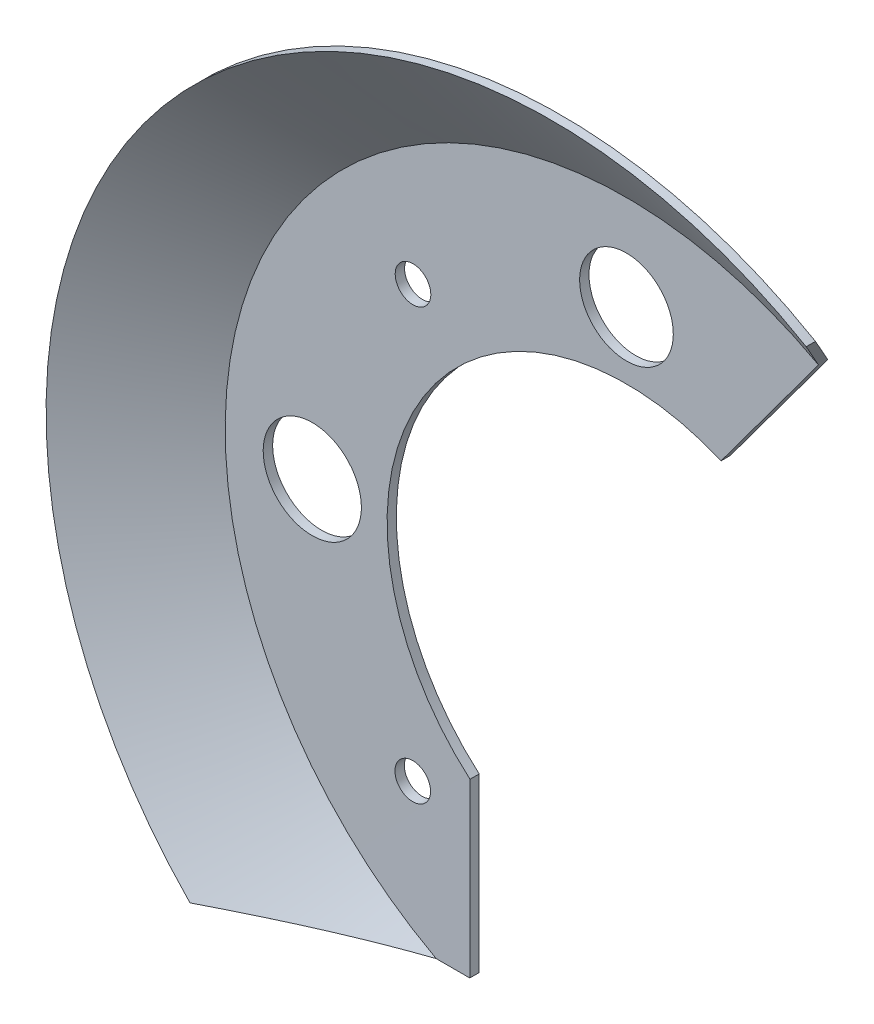
from build123d import *

# Parameters (mm, degrees)
CUT_EXTRUDE1_DEPTH      = 257.457873087
CUT_EXTRUDE1_DEPTH_BACK = 257.457873087
SKETCH5_R               = 6.35
CUT_EXTRUDE4_DEPTH      = 257.457873098
SKETCH6_R               = 16.711436386
SKETCH6_R_2             = 17.485757022
CUT_EXTRUDE5_DEPTH      = 257.83197321
SKETCH7_W               = 38.686396819
SKETCH7_H               = 81.826205817
CUT_EXTRUDE6_DEPTH      = 257.457873098
CUT_EXTRUDE7_DEPTH      = 257.457873098
CUT_EXTRUDE7_DEPTH_BACK = 257.457873098
CUT_EXTRUDE8_START      = -3.381369738
CUT_EXTRUDE8_DEPTH      = 30.084768361


# Read off the part's stored shape, not the designer's step: Cut-Extrude8
with BuildPart() as part:
    # Sweep2: sweep along a path in Sketch1
    with BuildLine(Plane.XY) as sweep2_path:
        CenterArc((0, 0), 139.7, 0, 360)
    # Sketch2 → Sweep2 (sweep)
    with BuildSketch(Plane(origin=(0, 0, 0), x_dir=(0, 0, -1), z_dir=(1, 0, 0))):
        Polygon((0.081951645, 85.453687679), (0, 143.147726507), (-26.703398523, 180.357380187), (-23.40398043, 180.357380187), (3.381369738, 143.033531592), (3.381369738, 85.453687679), align=None)
    sweep(path=sweep2_path.line)

    # Sketch3 → Cut-Extrude1 (cut, two sides: drawn at the far end of the back side and taken through both)
    with BuildSketch(Plane.XY.offset(-CUT_EXTRUDE1_DEPTH_BACK)):
        Polygon((821.723604832, 900.839301856), (152.923564845, 137.799256234), (60.497234444, 32.34921564), (-41.171728997, -70.159987168), (-55.875917924, -70.159987168), (-55.875917924, -126.035905092), (-167.627753772, -126.035905092), (-167.627753772, -181.911823016), (-167.627753772, -1196.566249267), (1667.740204928, -2062.313830848), (2657.091563532, 35.091720274), align=None)
    extrude(amount=CUT_EXTRUDE1_DEPTH + CUT_EXTRUDE1_DEPTH_BACK, mode=Mode.SUBTRACT)

    # Sketch5 → Cut-Extrude4 (cut, through all)
    with BuildSketch(Plane.XY):
        with Locations((-76.174636448, 78.185490602)):
            Circle(SKETCH5_R)
        with Locations((-76.260331952, -75.414325116)):
            Circle(SKETCH5_R)
    extrude(amount=-CUT_EXTRUDE4_DEPTH, mode=Mode.SUBTRACT)

    # Sketch6 → Cut-Extrude5 (cut, through all)
    with BuildSketch(Plane(origin=(0, 0, -3.381369738), x_dir=(-1, 0, 0), z_dir=(0, 0, -1))):
        with Locations((0, 109.236739893)):
            Circle(SKETCH6_R)
        with Locations((112.112202079, 0)):
            Circle(SKETCH6_R_2)
    extrude(amount=-CUT_EXTRUDE5_DEPTH, mode=Mode.SUBTRACT)

    # Sketch7 → Cut-Extrude6 (cut, through all)
    with BuildSketch(Plane.XY):
        with Locations((-36.532719515, -85.122802183)):
            Rectangle(SKETCH7_W, SKETCH7_H)
    extrude(amount=-CUT_EXTRUDE6_DEPTH, mode=Mode.SUBTRACT)

    # Sketch8 → Cut-Extrude7 (cut, two sides: drawn at the far end of the back side and taken through both)
    with BuildSketch(Plane.XY.offset(-CUT_EXTRUDE7_DEPTH_BACK)):
        with BuildLine():
            Line((517.613905497, -613.797286977), (111.177648296, 90.170960534))
            Line((111.177648296, 90.170960534), (95.308152083, 117.657734266))
            ThreePointArc((95.308152083, 117.657734266), (92.009440132, 125.621529396), (90.884310916, 134.167734266))
            Line((90.884310916, 134.167734266), (90.884310916, 169.901611192))
            Line((90.884310916, 169.901611192), (90.884310916, 982.774125595))
            Line((90.884310916, 982.774125595), (1661.496369245, 1402.565336698))
            Line((1661.496369245, 1402.565336698), (2088.225963826, -194.006075874))
            Line((2088.225963826, -194.006075874), (517.613905497, -613.797286977))
        make_face()
    extrude(amount=CUT_EXTRUDE7_DEPTH + CUT_EXTRUDE7_DEPTH_BACK, mode=Mode.SUBTRACT)

    # Cut-Extrude8 outline → Cut-Extrude8 (cut)
    with BuildSketch(Plane.XY.offset(CUT_EXTRUDE8_START)):
        with BuildLine():
            Line((90.884310916, 155.784551921), (33.711604752, 78.522993084))
            ThreePointArc((33.711604752, 78.522993084), (55.441528266, 65.02745329), (72.203661887, 45.705185132))
            Line((72.203661887, 45.705185132), (111.177648296, 90.170960534))
            Line((111.177648296, 90.170960534), (95.308152083, 117.657734266))
            ThreePointArc((95.308152083, 117.657734266), (92.009440132, 125.621529397), (90.884310916, 134.167734266))
            Line((90.884310916, 134.167734266), (90.884310916, 155.784551921))
        make_face()
    extrude(amount=CUT_EXTRUDE8_DEPTH, mode=Mode.SUBTRACT)


solid = part.part
